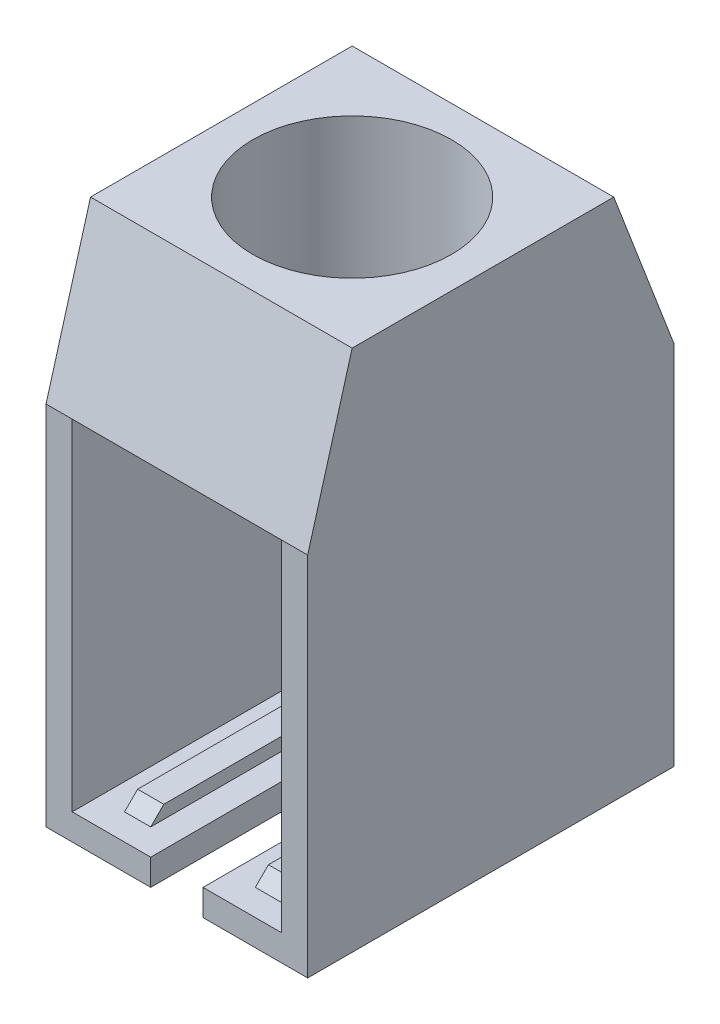
from build123d import *

# Parameters (mm, degrees)
SKETCH1_W           = 5
SKETCH1_H           = 7
BOSS_EXTRUDE1_DEPTH = 10
CUT_EXTRUDE1_DEPTH  = 12.715374514
SKETCH3_W           = 4
SKETCH3_H           = 6
CUT_EXTRUDE2_DEPTH  = 6.5
CUT_EXTRUDE3_REACH  = 12.886
SKETCH4_R           = 1.9
CUT_EXTRUDE4_REACH  = 12.886
SKETCH6_W           = 0.5
SKETCH6_H           = 6
BOSS_EXTRUDE3_DEPTH = 0.25
CHAMFER1_SIZE       = 0.25
CHAMFER2_SIZE       = 0.5


with BuildPart() as part:
    # Sketch1 → Boss-Extrude1 (new body)
    with BuildSketch(Plane(origin=(0, 0, 0), x_dir=(1, 0, 0), z_dir=(0, 1, 0))):
        Rectangle(SKETCH1_W, SKETCH1_H)
    extrude(amount=BOSS_EXTRUDE1_DEPTH)

    # Sketch2 → Cut-Extrude1 (cut, through all)
    with BuildSketch(Plane(origin=(2.5, 0, 0), x_dir=(0, 0, -1), z_dir=(1, 0, 0))):
        Polygon((-3.5, 7), (-2.65, 10), (-3.5, 10), align=None)
        Polygon((2.35, 10), (3.5, 10), (3.5, 7), align=None)
    extrude(amount=-CUT_EXTRUDE1_DEPTH, mode=Mode.SUBTRACT)

    # Sketch3 → Cut-Extrude2 (cut)
    with BuildSketch(Plane.XY.offset(3.5)):
        with Locations((0, 3.5)):
            Rectangle(SKETCH3_W, SKETCH3_H)
    extrude(amount=-CUT_EXTRUDE2_DEPTH, mode=Mode.SUBTRACT)

    # Sketch4 → Cut-Extrude3 (cut, up to next)
    with BuildSketch(Plane(origin=(0, 10, 0), x_dir=(1, 0, 0), z_dir=(0, 1, 0)), mode=Mode.PRIVATE) as cut_extrude3_sk1:
        with Locations(Location((0, -0.15, 0), (0, 0, 270))):
            Circle(SKETCH4_R)
    cut_extrude3_tool1 = extrude(cut_extrude3_sk1.sketch, amount=-CUT_EXTRUDE3_REACH, mode=Mode.PRIVATE) & part.part
    add(cut_extrude3_tool1.solids().sort_by_distance((0, 10, 0.15))[0], mode=Mode.SUBTRACT)

    # Sketch5 → Cut-Extrude4 (cut, up to next)
    with BuildSketch(Plane.XZ, mode=Mode.PRIVATE) as cut_extrude4_sk1:
        with BuildLine():
            Line((-0.5, 3.5), (-0.5, 0.15))
            ThreePointArc((-0.5, 0.15), (0, -0.35), (0.5, 0.15))
            Line((0.5, 0.15), (0.5, 3.5))
            Line((0.5, 3.5), (-0.5, 3.5))
        make_face()
    cut_extrude4_tool1 = extrude(cut_extrude4_sk1.sketch, amount=-CUT_EXTRUDE4_REACH, mode=Mode.PRIVATE) & part.part
    add(cut_extrude4_tool1.solids().sort_by_distance((0, 0, 1.626987))[0], mode=Mode.SUBTRACT)

    # Sketch6 → Boss-Extrude3 (add)
    with BuildSketch(Plane(origin=(0, 0.5, 0), x_dir=(1, 0, 0), z_dir=(0, 1, 0))):
        with Locations((-1.25, 0)):
            Rectangle(SKETCH6_W, SKETCH6_H)
        Polygon((1.5, 3), (1, 3), (1, -3), (1.5, -3), (1.5, 0), align=None)
    extrude(amount=BOSS_EXTRUDE3_DEPTH)

    # Chamfer1
    chamfer1_edges = [part.edges().sort_by_distance(p)[0] for p in [
        (1.25, 0.75, 3),
        (-1.25, 0.75, 3),
    ]]
    chamfer(chamfer1_edges, length=CHAMFER1_SIZE - 0.0001)  # a hair under: the kernel refuses the full size

    # Chamfer2
    chamfer2_edges = [part.edges().sort_by_distance(p)[0] for p in [
        (0, 6.5, 3.5),
    ]]
    chamfer(chamfer2_edges, length=CHAMFER2_SIZE - 0.0001)  # a hair under: the kernel refuses the full size


solid = part.part
